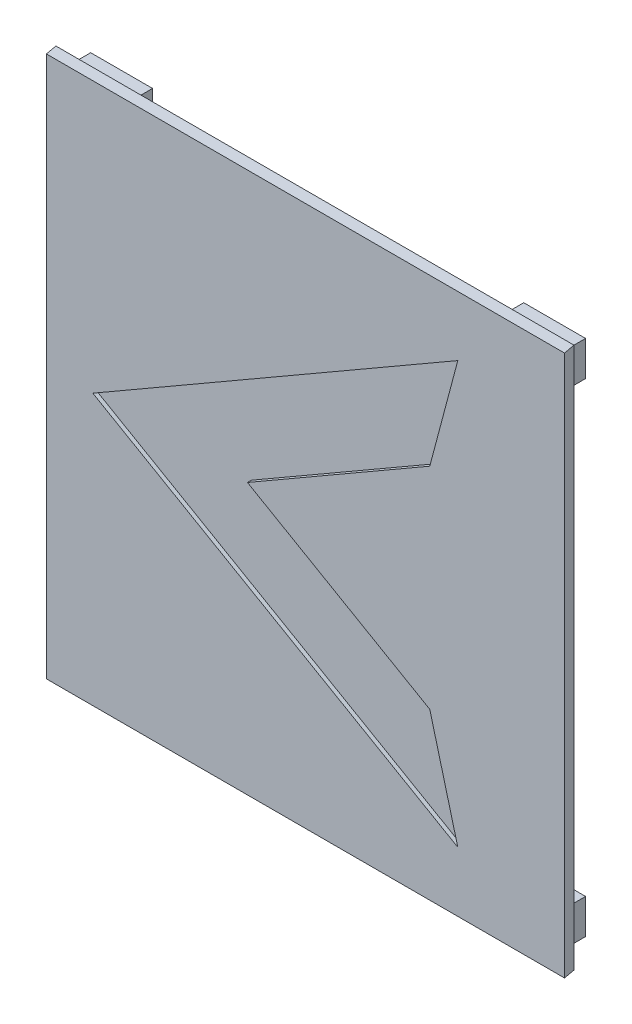
from build123d import *

# Parameters (mm, degrees)
SKETCH1_W                 = 67.008250425
SKETCH1_H                 = 70
BOSS_EXTRUDE1_DEPTH       = 1.5
BOSS_EXTRUDE2_START       = -9.75
BOSS_EXTRUDE2_DEPTH       = 70
CUT_EXTRUDE1_START        = -6
CUT_EXTRUDE1_OUTLINE_W    = 73
CUT_EXTRUDE1_OUTLINE_H    = 4
CUT_EXTRUDE1_DEPTH        = 1.741494861
SKETCH4_W                 = 8
SKETCH4_H                 = 4.5
SKETCH4_W_2               = 5
SKETCH4_H_2               = 1.5
BOSS_EXTRUDE3_DEPTH       = 3
MIRROR2_COPY_1_SKETCH_W   = 8
MIRROR2_COPY_1_SKETCH_H   = 4.5
MIRROR2_COPY_1_SKETCH_W_2 = 5
MIRROR2_COPY_1_SKETCH_H_2 = 1.5
MIRROR2_COPY_1_DEPTH      = 3
CUT_EXTRUDE2_DEPTH        = 0.5


with BuildPart() as part:
    # Sketch1 → Boss-Extrude1 (new body)
    with BuildSketch(Plane.XY):
        with Locations((29.175646202, 25.25)):
            Rectangle(SKETCH1_W, SKETCH1_H)
    extrude(amount=BOSS_EXTRUDE1_DEPTH)

    # Boss-Extrude2: read off the stored shape, not the designer's step
    # Boss-Extrude2 outline → Boss-Extrude2 (add)
    with BuildSketch(Plane(origin=(0, 0, 0), x_dir=(1, 0, 0), z_dir=(0, 1, 0)).offset(BOSS_EXTRUDE2_START)):
        Polygon((62.952808957, -1.5), (62.679771414, 0), (62.679771414, -1.5), align=None)
    extrude(amount=BOSS_EXTRUDE2_DEPTH)

    # Cut-Extrude1: read off the stored shape, not the designer's step
    # Cut-Extrude1 outline → Cut-Extrude1 (cut)
    with BuildSketch(Plane(origin=(0, 0, 0), x_dir=(0, 1, 0), z_dir=(0.9838340738940914, 0, -0.17908242528220206)).offset(CUT_EXTRUDE1_START)):
        with Locations((25.5, 0)):
            Rectangle(CUT_EXTRUDE1_OUTLINE_W, CUT_EXTRUDE1_OUTLINE_H)
    extrude(amount=CUT_EXTRUDE1_DEPTH, mode=Mode.SUBTRACT)

    # Sketch4 → Boss-Extrude3 (add)
    with BuildSketch(Plane(origin=(0, 0, 0), x_dir=(-1, 0, 0), z_dir=(0, 0, -1))):
        with Locations((-1.171520989, 56.5)):
            Rectangle(SKETCH4_W, SKETCH4_H)
        with Locations((-1.171520989, 56.5)):
            Rectangle(SKETCH4_W_2, SKETCH4_H_2, mode=Mode.SUBTRACT)
    boss_extrude3 = extrude(amount=BOSS_EXTRUDE3_DEPTH)

    # Mirror1: Boss-Extrude3 across plane
    add(boss_extrude3.mirror(Plane(origin=(29.175646202, 0, 0), x_dir=(0, 0, 1), z_dir=(1, 0, 0))))

    # Mirror2: Boss-Extrude3 across plane
    add(boss_extrude3.mirror(Plane(origin=(0, 25.25, 0), x_dir=(0, 0, 1), z_dir=(0, -1, 0))))

    # Mirror2 copy 1 sketch → Mirror2 copy 1 (add)
    with BuildSketch(Plane(origin=(58.351292403, 50.5, 0), x_dir=(1, 0, 0), z_dir=(0, 0, -1))):
        with Locations((-1.171520989, 56.5)):
            Rectangle(MIRROR2_COPY_1_SKETCH_W, MIRROR2_COPY_1_SKETCH_H)
        with Locations((-1.171520989, 56.5)):
            Rectangle(MIRROR2_COPY_1_SKETCH_W_2, MIRROR2_COPY_1_SKETCH_H_2, mode=Mode.SUBTRACT)
    extrude(amount=MIRROR2_COPY_1_DEPTH)

    # Sketch6 → Cut-Extrude2 (cut)
    with BuildSketch(Plane.XY.offset(1.5)):
        Polygon((45.526638666, 38.865120313), (49.152363366, 52.505438829), (1.944558532, 25.25), (49.152363366, -2.005438829), (45.526638666, 11.634879687), (21.944558532, 25.25), align=None)
    extrude(amount=-CUT_EXTRUDE2_DEPTH, mode=Mode.SUBTRACT)


solid = part.part
